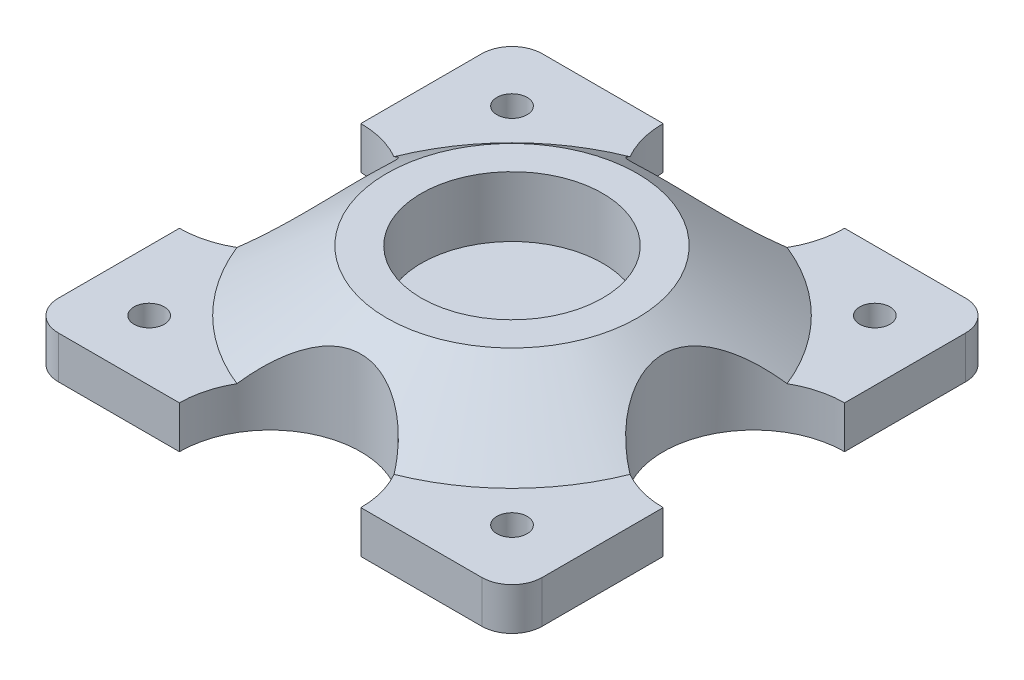
from build123d import *

# Parameters (mm, degrees)
SKETCH1_W           = 101.6
SKETCH1_H           = 101.6
BOSS_EXTRUDE1_DEPTH = 8.89
SKETCH2_R           = 44.45
BOSS_EXTRUDE2_DEPTH = 12.7
FILLET1_R           = 6.35
SKETCH5_R           = 3.175
CUT_EXTRUDE1_DEPTH  = 73.955945611
CHAMFER1_SIZE2      = 18.137479686
CHAMFER1_SIZE       = 12.7
SKETCH6_R           = 19.05
CUT_EXTRUDE2_DEPTH  = 12.7
SKETCH7_R           = 19.05
CUT_EXTRUDE3_DEPTH  = 76.016052282


with BuildPart() as part:
    # Sketch1 → Boss-Extrude1 (new body)
    with BuildSketch(Plane(origin=(0, 0, 0), x_dir=(1, 0, 0), z_dir=(0, 1, 0))):
        Rectangle(SKETCH1_W, SKETCH1_H)
    extrude(amount=BOSS_EXTRUDE1_DEPTH)

    # Sketch2 → Boss-Extrude2 (add)
    with BuildSketch(Plane(origin=(0, 8.89, 0), x_dir=(1, 0, 0), z_dir=(0, 1, 0))):
        with Locations(Location((0, 0, 0), (0, 0, 270))):
            Circle(SKETCH2_R)
    extrude(amount=BOSS_EXTRUDE2_DEPTH)

    # Fillet1
    fillet1_edges = [part.edges().sort_by_distance(p)[0] for p in [
        (-50.8, 4.445, -50.8),
        (50.8, 4.445, -50.8),
        (50.8, 4.445, 50.8),
        (-50.8, 4.445, 50.8),
    ]]
    fillet(fillet1_edges, radius=FILLET1_R)

    # Sketch5 → Cut-Extrude1 (cut, through all)
    with BuildSketch(Plane(origin=(0, 8.89, 0), x_dir=(1, 0, 0), z_dir=(0, 1, 0))):
        with Locations(Location((-38.1, 38.1, 0), (0, 0, 270))):
            Circle(SKETCH5_R)
        with Locations(Location((38.1, 38.1, 0), (0, 0, 270))):
            Circle(SKETCH5_R)
        with Locations(Location((-38.1, -38.1, 0), (0, 0, 270))):
            Circle(SKETCH5_R)
        with Locations(Location((38.1, -38.1, 0), (0, 0, 270))):
            Circle(SKETCH5_R)
    extrude(amount=-CUT_EXTRUDE1_DEPTH, mode=Mode.SUBTRACT)

    # Chamfer1
    chamfer1_edges = [part.edges().sort_by_distance(p)[0] for p in [
        (0, 21.59, -44.45),
    ]]
    chamfer1_side = [part.faces().sort_by_distance(p)[0] for p in [
        (0, 21.336, -44.45),
    ]]
    chamfer(chamfer1_edges, length=CHAMFER1_SIZE - 0.0001, length2=CHAMFER1_SIZE2 - 0.0001, reference=chamfer1_side[0])  # a hair under: the kernel refuses the full size

    # Sketch6 → Cut-Extrude2 (cut)
    with BuildSketch(Plane(origin=(0, 21.59, 0), x_dir=(1, 0, 0), z_dir=(0, 1, 0))):
        with Locations(Location((0, 0, 0), (0, 0, 270))):
            Circle(SKETCH6_R)
    extrude(amount=-CUT_EXTRUDE2_DEPTH, mode=Mode.SUBTRACT)

    # Sketch7 → Cut-Extrude3 (cut, through all)
    with BuildSketch(Plane(origin=(0, 0, 0), x_dir=(1, 0, 0), z_dir=(0, 1, 0))):
        with Locations((-50.8, 0)):
            Circle(SKETCH7_R)
        with Locations((0, 50.8)):
            Circle(SKETCH7_R)
        with Locations((50.8, 0)):
            Circle(SKETCH7_R)
        with Locations((0, -50.8)):
            Circle(SKETCH7_R)
    extrude(amount=CUT_EXTRUDE3_DEPTH, mode=Mode.SUBTRACT)


solid = part.part
